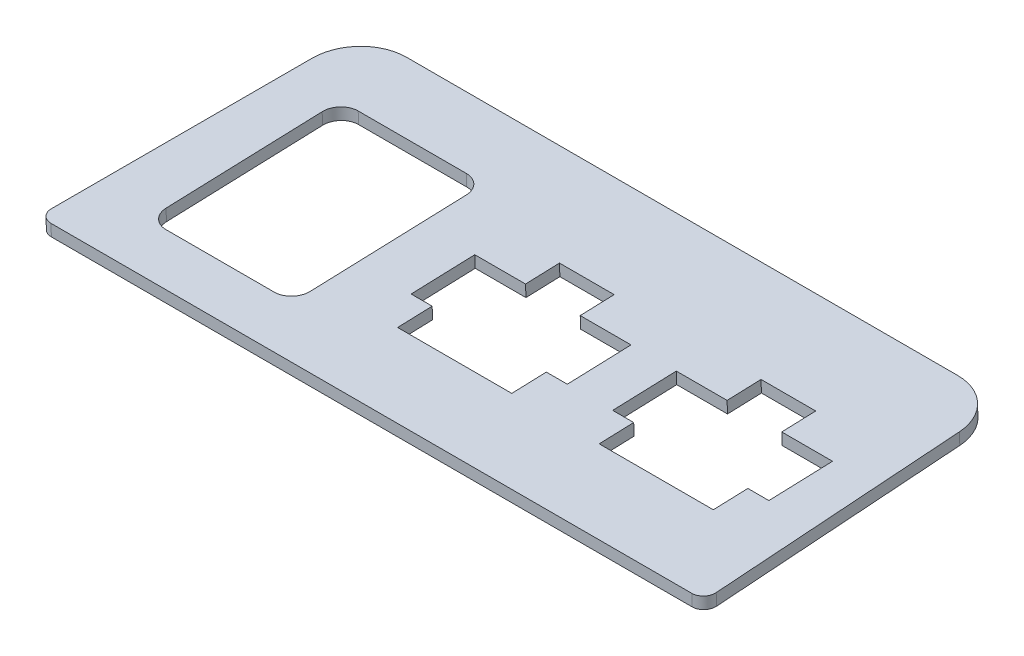
from build123d import *

# Parameters (mm, degrees)
BOSS_EXTRUDE1_DEPTH = 2
CUT_EXTRUDE1_REACH  = 75.082
FILLET1_R           = 2


with BuildPart() as part:
    # Sketch1 → Boss-Extrude1 (new body)
    with BuildSketch(Plane(origin=(0, -69.240689652, -2.417938163), x_dir=(1, 0, 0), z_dir=(0, 0.9993908270190958, 0.03489949670250105))):
        with BuildLine():
            Line((-55.400321558, -4.20689679), (55.400321558, -4.20689679))
            Line((55.400321558, -4.20689679), (53.862501323, 39.830512956))
            ThreePointArc((53.862501323, 39.830512956), (51.42464167, 45.306035386), (45.867374707, 47.551316983))
            Line((45.867374707, 47.551316983), (-45.867374707, 47.551316983))
            ThreePointArc((-45.867374707, 47.551316983), (-51.42464167, 45.306035386), (-53.862501323, 39.830512956))
            Line((-53.862501323, 39.830512956), (-55.400321558, -4.20689679))
        make_face()
    extrude(amount=BOSS_EXTRUDE1_DEPTH)

    # Sketch2 → Cut-Extrude1 (cut, up to next)
    with BuildSketch(Plane(origin=(0, -69.240689652, -2.417938163), x_dir=(1, 0, 0), z_dir=(0, -0.9993908270190958, -0.03489949670250106)), mode=Mode.PRIVATE) as cut_extrude1_sk1:
        Polygon((-4.05, -25.522210096), (-4.05, -31.172210096), (5.05, -31.172210096), (5.05, -25.522210096), (13.5, -25.522210096), (13.5, -14.922210096), (10, -14.922210096), (10, -9.172210096), (-9, -9.172210096), (-9, -14.922210096), (-12.5, -14.922210096), (-12.5, -25.522210096), align=None)
    cut_extrude1_tool1 = extrude(cut_extrude1_sk1.sketch, amount=-CUT_EXTRUDE1_REACH, mode=Mode.PRIVATE) & part.part
    # Sketch2 → Cut-Extrude1 (cut, up to next)
    with BuildSketch(Plane(origin=(0, -69.240689652, -2.417938163), x_dir=(1, 0, 0), z_dir=(0, -0.9993908270190958, -0.03489949670250106)), mode=Mode.PRIVATE) as cut_extrude1_sk2:
        with BuildLine():
            Line((-42.547155753, -4.172210096), (-24.547155753, -4.172210096))
            ThreePointArc((-24.547155753, -4.172210096), (-22.425835409, -5.050889753), (-21.547155753, -7.172210096))
            Line((-21.547155753, -7.172210096), (-21.547155753, -33.172210096))
            ThreePointArc((-21.547155753, -33.172210096), (-22.425835409, -35.29353044), (-24.547155753, -36.172210096))
            Line((-24.547155753, -36.172210096), (-42.547155753, -36.172210096))
            ThreePointArc((-42.547155753, -36.172210096), (-44.668476096, -35.29353044), (-45.547155753, -33.172210096))
            Line((-45.547155753, -33.172210096), (-45.547155753, -7.172210096))
            ThreePointArc((-45.547155753, -7.172210096), (-44.668476096, -5.050889753), (-42.547155753, -4.172210096))
        make_face()
    cut_extrude1_tool2 = extrude(cut_extrude1_sk2.sketch, amount=-CUT_EXTRUDE1_REACH, mode=Mode.PRIVATE) & part.part
    # Sketch2 → Cut-Extrude1 (cut, up to next)
    with BuildSketch(Plane(origin=(0, -69.240689652, -2.417938163), x_dir=(1, 0, 0), z_dir=(0, -0.9993908270190958, -0.03489949670250106)), mode=Mode.PRIVATE) as cut_extrude1_sk3:
        Polygon((29.497155753, -25.522210096), (21.047155753, -25.522210096), (21.047155753, -14.922210096), (24.547155753, -14.922210096), (24.547155753, -9.172210096), (43.547155753, -9.172210096), (43.547155753, -14.922210096), (47.047155753, -14.922210096), (47.047155753, -25.522210096), (38.597155753, -25.522210096), (38.597155753, -31.172210096), (29.497155753, -31.172210096), align=None)
    cut_extrude1_tool3 = extrude(cut_extrude1_sk3.sketch, amount=-CUT_EXTRUDE1_REACH, mode=Mode.PRIVATE) & part.part
    add(cut_extrude1_tool1.solids().sort_by_distance((0.5, -68.572973, -21.538853))[0], mode=Mode.SUBTRACT)
    add(cut_extrude1_tool2.solids().sort_by_distance((-33.547156, -68.53669, -22.57786))[0], mode=Mode.SUBTRACT)
    add(cut_extrude1_tool3.solids().sort_by_distance((34.047156, -68.572973, -21.538853))[0], mode=Mode.SUBTRACT)

    # Fillet1
    fillet1_edges = [part.edges().sort_by_distance(p)[0] for p in [
        (-55.400321558, -68.388117405, 1.821295396),
        (55.400321558, -68.388117405, 1.821295396),
    ]]
    fillet(fillet1_edges, radius=FILLET1_R)


solid = part.part
